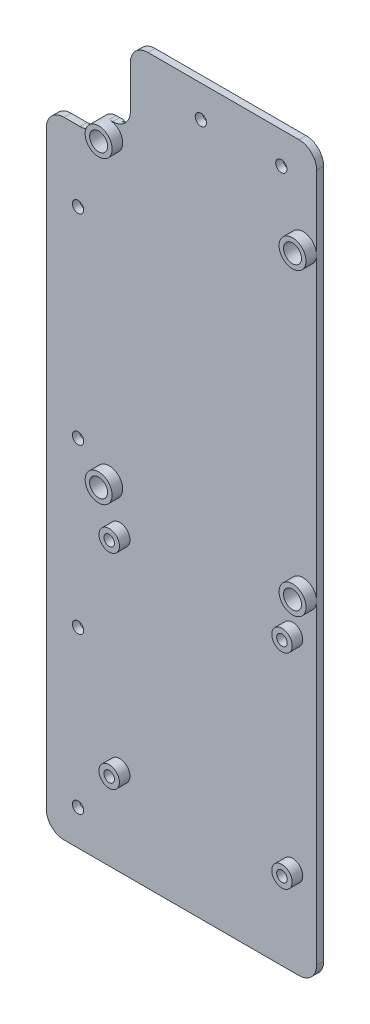
from build123d import *

# Parameters (mm, degrees)
SKETCH1_R             = 3.825
SKETCH1_R_2           = 2.525
BOSS_EXTRUDE1_DEPTH   = 3
BOSS_EXTRUDE1_2_DEPTH = 3
BOSS_EXTRUDE1_3_DEPTH = 3
BOSS_EXTRUDE1_4_DEPTH = 3
BOSS_EXTRUDE2_START   = 2
BOSS_EXTRUDE2_DEPTH   = 2
SKETCH4_R             = 1.6
BOSS_EXTRUDE3_DEPTH   = 2
SKETCH6_R             = 2.55
CUT_EXTRUDE1_DEPTH    = 4.2
BOSS_EXTRUDE4_START   = -2
BOSS_EXTRUDE4_DEPTH   = 2
SKETCH10_R            = 2.9
SKETCH10_R_2          = 1.5
BOSS_EXTRUDE5_DEPTH   = 3
CUT_EXTRUDE2_START    = -3.1
SKETCH11_R            = 1.5
CUT_EXTRUDE2_DEPTH    = 3.1
FILLET1_R             = 5
SKETCH12_R            = 1.6
CUT_EXTRUDE3_DEPTH    = 2
CUT_EXTRUDE4_DEPTH    = 1
FILLET2_R             = 1


# Some blends are built 0.0001 mm under size
with BuildPart() as part:
    # Sketch1 → Boss-Extrude1 (new body)
    with BuildSketch(Plane(origin=(0, 0, 0), x_dir=(0, 1, 0), z_dir=(0, 0, 1))):
        with Locations(Location((42.5, 27.5, 0), (0, 0, 270))):
            Circle(SKETCH1_R)
        with Locations(Location((42.5, 27.5, 0), (0, 0, 270))):
            Circle(SKETCH1_R_2, mode=Mode.SUBTRACT)
    extrude(amount=BOSS_EXTRUDE1_DEPTH)



with BuildPart() as body_2:
    # Sketch1 → Boss-Extrude1 2 (new body)
    with BuildSketch(Plane(origin=(0, 0, 0), x_dir=(0, 1, 0), z_dir=(0, 0, 1))):
        with Locations(Location((-42.5, 27.5, 0), (0, 0, 270))):
            Circle(SKETCH1_R)
        with Locations(Location((-42.5, 27.5, 0), (0, 0, 270))):
            Circle(SKETCH1_R_2, mode=Mode.SUBTRACT)
    extrude(amount=BOSS_EXTRUDE1_2_DEPTH)


with BuildPart() as body_3:
    # Sketch1 → Boss-Extrude1 3 (new body)
    with BuildSketch(Plane(origin=(0, 0, 0), x_dir=(0, 1, 0), z_dir=(0, 0, 1))):
        with Locations(Location((-42.5, -27.5, 0), (0, 0, 270))):
            Circle(SKETCH1_R)
        with Locations(Location((-42.5, -27.5, 0), (0, 0, 270))):
            Circle(SKETCH1_R_2, mode=Mode.SUBTRACT)
    extrude(amount=BOSS_EXTRUDE1_3_DEPTH)


with BuildPart() as body_4:
    # Sketch1 → Boss-Extrude1 4 (new body)
    with BuildSketch(Plane(origin=(0, 0, 0), x_dir=(0, 1, 0), z_dir=(0, 0, 1))):
        with Locations(Location((42.5, -27.5, 0), (0, 0, 270))):
            Circle(SKETCH1_R)
        with Locations(Location((42.5, -27.5, 0), (0, 0, 270))):
            Circle(SKETCH1_R_2, mode=Mode.SUBTRACT)
    extrude(amount=BOSS_EXTRUDE1_4_DEPTH)


with BuildPart() as part_1:
    add(part.part)

    add(body_2.part)  # Boss-Extrude2 merges body 2

    add(body_3.part)  # Boss-Extrude2 merges body 3

    add(body_4.part)  # Boss-Extrude2 merges body 4
    # Sketch3 → Boss-Extrude2 (add)
    with BuildSketch(Plane(origin=(0, 0, 0), x_dir=(1, 0, 0), z_dir=(0, 0, -1)).offset(BOSS_EXTRUDE2_START)):
        with BuildLine():
            Line((-31.325, -42.5), (-31.325, 42.5))
            ThreePointArc((-31.325, 42.5), (-30.204683438, 45.204683438), (-27.5, 46.325))
            Line((-27.5, 46.325), (27.5, 46.325))
            ThreePointArc((27.5, 46.325), (30.204683438, 45.204683438), (31.325, 42.5))
            Line((31.325, 42.5), (31.325, -42.5))
            ThreePointArc((31.325, -42.5), (30.204683438, -45.204683438), (27.5, -46.325))
            Line((27.5, -46.325), (-27.5, -46.325))
            ThreePointArc((-27.5, -46.325), (-30.204683438, -45.204683438), (-31.325, -42.5))
        make_face()
    extrude(amount=-BOSS_EXTRUDE2_DEPTH)

    # Sketch4 → Boss-Extrude3 (add)
    # profile 1 of 2: a face of its own
    with BuildSketch(Plane.XY):
        Polygon((-27.5, -46.325), (-45.325, -46.325), (-45.325, 40.5), (-31.325, 40.5), (-31.325, -42.5), align=None)
        with Locations((-36.325, 20.5)):
            Circle(SKETCH4_R, mode=Mode.SUBTRACT)
        with Locations((-36.325, -36.325)):
            Circle(SKETCH4_R, mode=Mode.SUBTRACT)
    # profile 2 of 2: a face of its own
    with BuildSketch(Plane.XY):
        Polygon((31.325, 42.5), (31.325, 68.325), (-21.5, 68.325), (-21.5, 46.325), (27.5, 46.325), align=None)
        with Locations((21.325, 59.325)):
            Circle(SKETCH4_R, mode=Mode.SUBTRACT)
        with Locations((-1.5, 59.325)):
            Circle(SKETCH4_R, mode=Mode.SUBTRACT)
    extrude(amount=-BOSS_EXTRUDE3_DEPTH)

    # Sketch6 → Cut-Extrude1 (cut)
    with BuildSketch(Plane.XY.offset(3)):
        with Locations((-27.5, 42.5)):
            Circle(SKETCH6_R)
        with Locations((27.5, 42.5)):
            Circle(SKETCH6_R)
        with Locations((27.5, -42.5)):
            Circle(SKETCH6_R)
        with Locations((-27.5, -42.5)):
            Circle(SKETCH6_R)
    extrude(amount=-CUT_EXTRUDE1_DEPTH, mode=Mode.SUBTRACT)

    # Sketch9 → Boss-Extrude4 (add)
    with BuildSketch(Plane.XY.offset(BOSS_EXTRUDE4_START)):
        with BuildLine():
            Line((-45.325, -46.325), (27.5, -46.325))
            ThreePointArc((27.5, -46.325), (30.204683438, -45.204683438), (31.325, -42.5))
            Line((31.325, -42.5), (31.325, -137))
            Line((31.325, -137), (-45.325, -137))
            Line((-45.325, -137), (-45.325, -46.325))
        make_face()
    extrude(amount=BOSS_EXTRUDE4_DEPTH)

    # Sketch10 → Boss-Extrude5 (add)
    # profile 1 of 4: a face of its own
    with BuildSketch(Plane.XY):
        with Locations((-24.5, -112)):
            Circle(SKETCH10_R)
        with Locations((-24.5, -112)):
            Circle(SKETCH10_R_2, mode=Mode.SUBTRACT)
    # profile 2 of 4: a face of its own
    with BuildSketch(Plane.XY):
        with Locations((-24.5, -54)):
            Circle(SKETCH10_R)
        with Locations((-24.5, -54)):
            Circle(SKETCH10_R_2, mode=Mode.SUBTRACT)
    # profile 3 of 4: a face of its own
    with BuildSketch(Plane.XY):
        with Locations((24.5, -54)):
            Circle(SKETCH10_R)
        with Locations((24.5, -54)):
            Circle(SKETCH10_R_2, mode=Mode.SUBTRACT)
    # profile 4 of 4: a face of its own
    with BuildSketch(Plane.XY):
        with Locations((24.5, -112)):
            Circle(SKETCH10_R)
        with Locations((24.5, -112)):
            Circle(SKETCH10_R_2, mode=Mode.SUBTRACT)
    extrude(amount=BOSS_EXTRUDE5_DEPTH)

    # Sketch11 → Cut-Extrude2 (cut)
    with BuildSketch(Plane.XY.offset(3).offset(CUT_EXTRUDE2_START)):
        with Locations((-24.5, -112)):
            Circle(SKETCH11_R)
        with Locations((24.5, -112)):
            Circle(SKETCH11_R)
        with Locations((24.5, -54)):
            Circle(SKETCH11_R)
        with Locations((-24.5, -54)):
            Circle(SKETCH11_R)
    extrude(amount=CUT_EXTRUDE2_DEPTH, mode=Mode.SUBTRACT)

    # Fillet1
    # the kernel refuses this fillet: 5 mm, written as the material it adds along each edge
    with BuildSketch(Plane(origin=(-21.5, 46.325, 0), x_dir=(-1, 0, 0), z_dir=(0, 0, -1))) as fillet1_piece_1:
        with BuildLine():
            CenterArc((FILLET1_R, FILLET1_R), FILLET1_R, 180, 90)
            Line((0, FILLET1_R), (0, 0))
            Line((0, 0), (FILLET1_R, 0))
        make_face()
    extrude(amount=2)
    with BuildSketch(Plane(origin=(-31.325, 40.5, 0), x_dir=(-1, 0, 0), z_dir=(0, 0, -1))) as fillet1_piece_2:
        with BuildLine():
            CenterArc((4.474435222, 5), FILLET1_R, 199.873422245, 70.126577755)
            Line((-0.227794366, 3.300283286), (-0.698017324, 3.130311615))
            ThreePointArc((-0.698017324, 3.130311615), (-0.5, 2), (-0.5, 0))
            Line((-0.5, 0), (0, -0.5))
            Line((0, -0.5), (4.474435222, -0.5))
            Line((4.474435222, -0.5), (4.474435222, 0))
        make_face()
    extrude(amount=2)
    # the kernel refuses this fillet: 5 mm, written as the material it takes off along each edge
    with BuildSketch(Plane(origin=(-45.325, 40.5, 12.5), x_dir=(0, -1, 0), z_dir=(0, 0, -1)), Plane(origin=(-21.5, 68.325, 12.5), x_dir=(0, -1, 0), z_dir=(0, 0, -1)), Plane(origin=(31.325, 68.325, 12.5), x_dir=(-1, 0, 0), z_dir=(0, 0, -1))) as fillet1_2_piece_1:
        with BuildLine():
            CenterArc((FILLET1_R, -FILLET1_R), FILLET1_R, 90, 90)
            Line((0, -FILLET1_R), (0, 0))
            Line((0, 0), (FILLET1_R, 0))
        make_face()
    extrude(amount=27, mode=Mode.SUBTRACT)
    with BuildSketch(Plane(origin=(-45.325, -137, -14.5), x_dir=(1, 0, 0), z_dir=(0, 0, 1)), Plane(origin=(31.325, -137, -14.5), x_dir=(0, 1, 0), z_dir=(0, 0, 1))) as fillet1_2_piece_2:
        with BuildLine():
            CenterArc((FILLET1_R, FILLET1_R), FILLET1_R, 180, 90)
            Line((0, FILLET1_R), (0, 0))
            Line((0, 0), (FILLET1_R, 0))
        make_face()
    extrude(amount=27, mode=Mode.SUBTRACT)

    # Sketch12 → Cut-Extrude3 (cut)
    with BuildSketch(Plane.XY):
        with Locations((-36.325, -127)):
            Circle(SKETCH12_R)
        with Locations((-36.325, -82.7952358)):
            Circle(SKETCH12_R)
    extrude(amount=-CUT_EXTRUDE3_DEPTH, mode=Mode.SUBTRACT)

    # Sketch14 → Cut-Extrude4 (cut)
    with BuildSketch(Plane.YX.offset(2)):
        with BuildLine():
            Line((19.725, -26.725), (49.725, 3.275))
            Line((49.725, 3.275), (49.725, -24.741163405))
            Line((49.725, -24.741163405), (45.149423643, -24.741163405))
            ThreePointArc((45.149423643, -24.741163405), (41.366713749, -23.846742923), (38.75433584, -26.725))
            Line((38.75433584, -26.725), (19.725, -26.725))
        make_face()
    extrude(amount=-CUT_EXTRUDE4_DEPTH, mode=Mode.SUBTRACT)

    # Fillet2
    fillet2_edges = [part_1.edges().sort_by_distance(p)[0] for p in [
        (-24.741163405, 45.896993144, -2),
        (-23.846742923, 41.366713749, -2),
        (-26.725, 29.23966792, -2),
        (-9.243956144, 49.725, -2),
        (-11.725, 34.725, -2),
    ]]
    fillet(fillet2_edges, radius=FILLET2_R - 0.0001)  # a hair under: the kernel refuses the full size


solid = part_1.part
